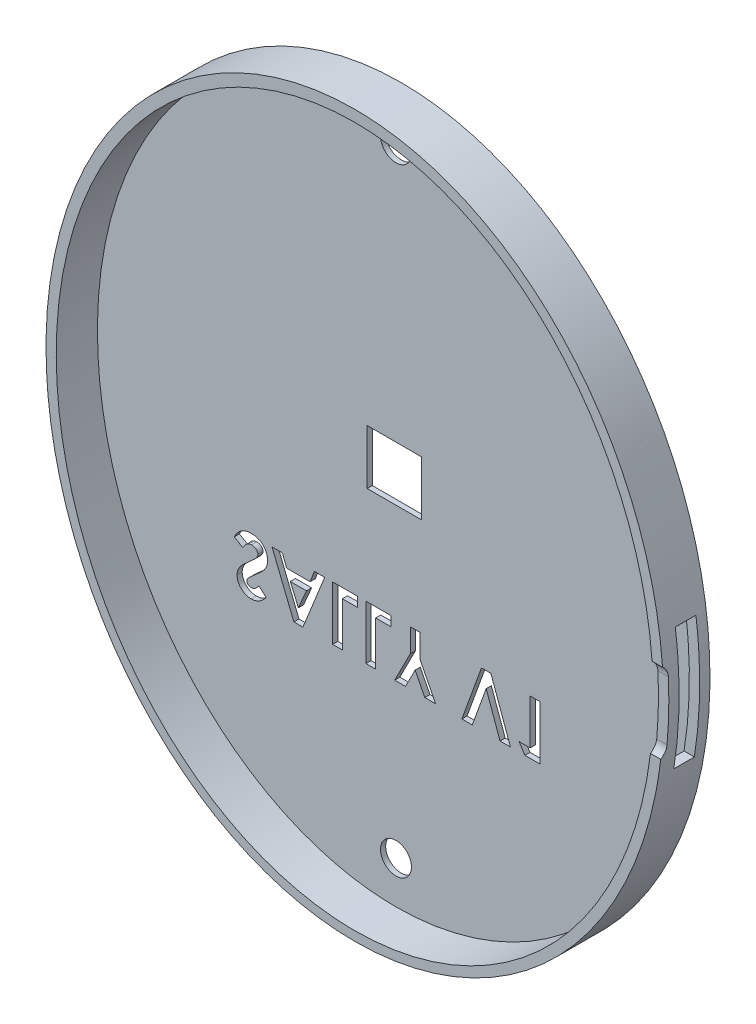
from build123d import *

# Parameters (mm, degrees)
SKETCH3_RX                     = 35
SKETCH3_RY                     = 30
BOSS_EXTRUDE2_DEPTH            = 4.5
SKETCH4_RX                     = 34
SKETCH4_RY                     = 29
CUT_EXTRUDE1_DEPTH             = 4
SCREWCUT_REACH                 = 48.274
SKETCH5_R                      = 1.5
SCREWCUT_DIRECTION_2_DEPTH     = 47.273686
LPATTERN1_COUNT                = 2
LPATTERN1_PITCH                = 60
SKETCH7_W                      = 5.3
SKETCH7_H                      = 5.3
CUT_EXTRUDE5_DEPTH             = 0.5
SALLYTV_START                  = -0.5
SALLYTV_DEPTH                  = 0.5
CUT_EXTRUDE6_REACH             = 71.604
SKETCH9_W                      = 2
SKETCH9_H                      = 12
CUT_EXTRUDE6_DIRECTION_2_DEPTH = 70.604181201


# Read off the part's stored shape, not the designer's step: SallyTV
with BuildPart() as part:
    # Sketch3 → Boss-Extrude2 (new body)
    with BuildSketch(Plane.XY):
        with Locations(Location((0.004233302, 0), (0, 0, 90))):
            Ellipse(SKETCH3_RX, SKETCH3_RY)
    extrude(amount=BOSS_EXTRUDE2_DEPTH)

    # Sketch4 → Cut-Extrude1 (cut)
    with BuildSketch(Plane.XY.offset(4.5)):
        with Locations(Location((0, -0.09801596), (0, 0, -90))):
            Ellipse(SKETCH4_RX, SKETCH4_RY)
    extrude(amount=-CUT_EXTRUDE1_DEPTH, mode=Mode.SUBTRACT)

    # Sketch5 → ScrewCut (cut, up to next)
    with BuildSketch(Plane.XY.offset(0.5), mode=Mode.PRIVATE) as screwcut_sk1:
        with Locations((0, -30)):
            Circle(SKETCH5_R)
    screwcut_tool1 = extrude(screwcut_sk1.sketch, amount=-SCREWCUT_REACH, mode=Mode.PRIVATE) & part.part
    screwcut = screwcut_tool1.solids().sort_by_distance((0, -30, 0.5))[0]
    add(screwcut, mode=Mode.SUBTRACT)

    # Sketch5 → ScrewCut direction 2 (cut)
    with BuildSketch(Plane.XY.offset(0.5)):
        with Locations((0, -30)):
            Circle(SKETCH5_R)
    screwcut_direction_2 = extrude(amount=SCREWCUT_DIRECTION_2_DEPTH, mode=Mode.SUBTRACT)

    # LPattern1: ScrewCut, ScrewCut direction 2 ×2
    with Locations(*[(0, i * LPATTERN1_PITCH, 0) for i in range(1, LPATTERN1_COUNT)]):
        add(screwcut, mode=Mode.SUBTRACT)
        add(screwcut_direction_2, mode=Mode.SUBTRACT)

    # Sketch7 → Cut-Extrude5 (cut)
    with BuildSketch(Plane(origin=(0, 0, 0), x_dir=(-1, 0, 0), z_dir=(0, 0, -1))):
        with Locations((0.15, 2.35)):
            Rectangle(SKETCH7_W, SKETCH7_H)
    extrude(amount=-CUT_EXTRUDE5_DEPTH, mode=Mode.SUBTRACT)

    # SallyTV outline → SallyTV (cut)
    # profile 1 of 7: a face of its own
    with BuildSketch(Plane(origin=(0, 0, 0), x_dir=(-1, 0, 0), z_dir=(0, 0, -1)).offset(SALLYTV_START)):
        with BuildLine():
            add(Edge.make_bspline(
                [(14.05841167, -15.219426964), (13.996554846, -15.217164109), (13.873329474, -15.212656263), (13.691137208, -15.177406375), (13.51317942, -15.121972214), (13.369777699, -15.055096997), (13.255675626, -14.990314942), (13.168227046, -14.930671787), (13.079243409, -14.862347348), (12.988007117, -14.785126315), (12.896213481, -14.697553743), (12.80125237, -14.601714367), (12.704417745, -14.49677991), (12.641490591, -14.42181522), (12.60919292, -14.383339223)],
                knots=[0, 0, 0, 0, 0.10691022, 0.212976528, 0.319776676, 0.428556273, 0.485856803, 0.546558687, 0.611431498, 0.67982091, 0.753158505, 0.830752869, 0.913133075, 1, 1, 1, 1], degree=3))
            add(Edge.make_bspline(
                [(15.436115996, -13.887996675), (15.434977205, -13.932944359), (15.432733663, -14.021496124), (15.412720922, -14.151698591), (15.382811118, -14.277333033), (15.339373496, -14.397941076), (15.282996707, -14.513371655), (15.214529287, -14.624189851), (15.132908067, -14.729375717), (15.040926462, -14.828859524), (14.939586283, -14.919776402), (14.831291423, -15.000019657), (14.716654841, -15.067794277), (14.596377826, -15.124018246), (14.46971507, -15.167054122), (14.337599692, -15.197560096), (14.199842197, -15.215704077), (14.106142523, -15.218170541), (14.05841167, -15.219426964)],
                knots=[0, 0, 0, 0, 0.06317288, 0.12445736, 0.184840915, 0.244566821, 0.304319173, 0.365199786, 0.427420983, 0.491261689, 0.555499002, 0.618604518, 0.680494764, 0.742473305, 0.804990665, 0.868251971, 0.932887217, 1, 1, 1, 1], degree=3))
            add(Edge.make_bspline(
                [(14.11309917, -12.045448598), (14.179922799, -12.101987797), (14.30817757, -12.210503632), (14.489417834, -12.370778104), (14.65273154, -12.520569284), (14.796708135, -12.661728919), (14.923182103, -12.791650116), (15.03129691, -12.911388146), (15.119864863, -13.021866624), (15.213063536, -13.152720988), (15.301620909, -13.312176022), (15.37815961, -13.504018913), (15.427814688, -13.695837461), (15.433377849, -13.82461387), (15.436115996, -13.887996675)],
                knots=[0, 0, 0, 0, 0.112124581, 0.215201009, 0.309902452, 0.395959096, 0.473447494, 0.542140328, 0.602523333, 0.654726333, 0.747804055, 0.835278417, 0.918925243, 1, 1, 1, 1], degree=3))
            add(Edge.make_bspline(
                [(13.416885227, -11.1399498), (13.418613888, -11.169907445), (13.422125496, -11.230763533), (13.44799092, -11.32124675), (13.488426466, -11.411688816), (13.536264569, -11.485871846), (13.584945829, -11.547983287), (13.631496094, -11.60180004), (13.688182002, -11.661258131), (13.754859824, -11.726432353), (13.830648571, -11.797896451), (13.915612085, -11.875643428), (14.010723289, -11.958988426), (14.077948075, -12.015762214), (14.11309917, -12.045448598)],
                knots=[0, 0, 0, 0, 0.076346606, 0.155090822, 0.238351561, 0.32840414, 0.37938386, 0.439617644, 0.509831416, 0.588874645, 0.677436354, 0.77554672, 0.882635872, 1, 1, 1, 1], degree=3))
            add(Edge.make_bspline(
                [(14.016344362, -10.642503887), (13.975485845, -10.64415631), (13.896214373, -10.647362252), (13.78306449, -10.676974573), (13.679324393, -10.723468089), (13.589652219, -10.789807925), (13.513723476, -10.866374178), (13.457683705, -10.951557636), (13.422479144, -11.043724081), (13.418757168, -11.107748957), (13.416885227, -11.1399498)],
                knots=[0, 0, 0, 0, 0.141985893, 0.275473311, 0.404345843, 0.535429711, 0.661427401, 0.77786684, 0.888279749, 1, 1, 1, 1], degree=3))
            add(Edge.make_bspline(
                [(14.876620804, -11.31558081), (14.846022588, -11.262393789), (14.787363193, -11.160429725), (14.687959364, -11.023428081), (14.586125216, -10.906108851), (14.479506435, -10.81054566), (14.369399465, -10.735460705), (14.255272464, -10.681799787), (14.137045248, -10.64858374), (14.056514239, -10.644527293), (14.016344362, -10.642503887)],
                knots=[0, 0, 0, 0, 0.160457921, 0.307611547, 0.442138888, 0.566229194, 0.681222208, 0.789558005, 0.895028892, 1, 1, 1, 1], degree=3))
            Line((14.876620804, -11.31558081), (15.705346766, -10.818134896))
            add(Edge.make_bspline(
                [(14.051049891, -9.700196194), (14.095951277, -9.700992775), (14.184881774, -9.702570461), (14.315951881, -9.715450956), (14.442514886, -9.736238705), (14.564428227, -9.766033758), (14.682241146, -9.803788132), (14.79595848, -9.849903654), (14.904795201, -9.905095096), (15.009574819, -9.968227504), (15.109787977, -10.041532545), (15.206701829, -10.123511522), (15.299353736, -10.215425309), (15.388188686, -10.317056533), (15.472638288, -10.428692989), (15.555466881, -10.548779932), (15.632993312, -10.679546015), (15.680884838, -10.771279479), (15.705346766, -10.818134896)],
                knots=[0, 0, 0, 0, 0.063551482, 0.125868382, 0.18624025, 0.244976651, 0.303357688, 0.361230317, 0.418489049, 0.475936712, 0.534203744, 0.594059429, 0.655468694, 0.718771685, 0.784974607, 0.853522316, 0.925182451, 1, 1, 1, 1], degree=3))
            add(Edge.make_bspline(
                [(12.474577535, -11.1946373), (12.475517293, -11.141614668), (12.477361133, -11.03758229), (12.499944634, -10.885346402), (12.532147382, -10.739650049), (12.581938479, -10.602078615), (12.642623573, -10.470373906), (12.718701104, -10.346587463), (12.808043731, -10.229466517), (12.910444101, -10.121104747), (13.023711068, -10.022773951), (13.145200656, -9.935237554), (13.27610085, -9.862965109), (13.41529326, -9.803453905), (13.562703378, -9.75761758), (13.718155596, -9.723740264), (13.881887688, -9.703407633), (13.993850052, -9.701282097), (14.051049891, -9.700196194)],
                knots=[0, 0, 0, 0, 0.065200875, 0.127926544, 0.18904691, 0.248543693, 0.307607127, 0.36724766, 0.426963056, 0.488617128, 0.550391855, 0.611330734, 0.672556085, 0.734024191, 0.797340621, 0.862249627, 0.929625466, 1, 1, 1, 1], degree=3))
            add(Edge.make_bspline(
                [(13.017245804, -12.398813983), (12.970896427, -12.348654031), (12.881796648, -12.252228987), (12.765998345, -12.102800495), (12.670692596, -11.956927817), (12.596962261, -11.811866123), (12.541278146, -11.665522461), (12.502020108, -11.514307761), (12.478508208, -11.356641924), (12.475897838, -11.249054238), (12.474577535, -11.1946373)],
                knots=[0, 0, 0, 0, 0.150833097, 0.289954183, 0.417138648, 0.535255184, 0.648751095, 0.762405462, 0.879826701, 1, 1, 1, 1], degree=3))
            add(Edge.make_bspline(
                [(13.693477775, -13.004583214), (13.6493153, -12.966362818), (13.565504096, -12.893828449), (13.446257396, -12.790877558), (13.341459408, -12.698255151), (13.249583462, -12.617351293), (13.17202231, -12.547317118), (13.108449884, -12.487817861), (13.058089754, -12.440011866), (13.029462969, -12.411137016), (13.017245804, -12.398813983)],
                knots=[0, 0, 0, 0, 0.192952702, 0.366184141, 0.520457298, 0.655012135, 0.770624226, 0.865677185, 0.942674527, 1, 1, 1, 1], degree=3))
            add(Edge.make_bspline(
                [(14.406518641, -13.681866867), (14.394444822, -13.66662424), (14.366652485, -13.631537724), (14.313658192, -13.575966153), (14.247108488, -13.507886114), (14.164442403, -13.42963868), (14.069091632, -13.338409768), (13.956636544, -13.237785621), (13.830314087, -13.124650025), (13.740527011, -13.045866493), (13.693477775, -13.004583214)],
                knots=[0, 0, 0, 0, 0.059234189, 0.136349281, 0.233805212, 0.349411224, 0.48317915, 0.635966856, 0.809243356, 1, 1, 1, 1], degree=3))
            add(Edge.make_bspline(
                [(14.493808304, -13.933219031), (14.492880859, -13.91136705), (14.491013112, -13.867360196), (14.472973221, -13.802862671), (14.445781955, -13.739841082), (14.419799589, -13.701476841), (14.406518641, -13.681866867)],
                knots=[0, 0, 0, 0, 0.241881375, 0.487115475, 0.73783784, 1, 1, 1, 1], degree=3))
            add(Edge.make_bspline(
                [(14.068928496, -14.277119271), (14.09883685, -14.276070387), (14.156582024, -14.274045268), (14.238902053, -14.253915735), (14.311986947, -14.219175116), (14.375765378, -14.173748835), (14.426287305, -14.119020698), (14.466625147, -14.061624953), (14.489338741, -13.998273032), (14.492328297, -13.954760376), (14.493808304, -13.933219031)],
                knots=[0, 0, 0, 0, 0.148126258, 0.285992887, 0.416634394, 0.547379946, 0.671582838, 0.784400739, 0.893265576, 1, 1, 1, 1], degree=3))
            add(Edge.make_bspline(
                [(13.313820323, -13.738657733), (13.34400354, -13.781234298), (13.401951107, -13.862975365), (13.495878068, -13.97242858), (13.589380901, -14.065800319), (13.683325853, -14.142700515), (13.778545615, -14.202661945), (13.874874901, -14.2451153), (13.971767592, -14.2721033), (14.036864524, -14.275463956), (14.068928496, -14.277119271)],
                knots=[0, 0, 0, 0, 0.162420307, 0.31182434, 0.448432767, 0.573381197, 0.689077147, 0.797572901, 0.900293043, 1, 1, 1, 1], degree=3))
            Line((13.313820323, -13.738657733), (12.60919292, -14.383339223))
        make_face()
    # profile 2 of 7: a face of its own
    with BuildSketch(Plane(origin=(0, 0, 0), x_dir=(-1, 0, 0), z_dir=(0, 0, -1)).offset(SALLYTV_START)):
        Polygon((-12.520765013, -15.084811579), (-11.958114773, -14.209811579), (-13.03503785, -14.209811579), (-13.03503785, -9.834811579), (-13.977345542, -9.834811579), (-13.977345542, -15.084811579), align=None)
    # profile 3 of 7: a face of its own
    with BuildSketch(Plane(origin=(0, 0, 0), x_dir=(-1, 0, 0), z_dir=(0, 0, -1)).offset(SALLYTV_START)):
        Polygon((-7.411690494, -15.084811579), (-6.405230157, -15.084811579), (-8.305620782, -9.834811579), (-9.214274629, -9.834811579), (-11.116768619, -15.084811579), (-10.111359965, -15.084811579), (-8.760999388, -11.355544752), align=None)
    # profile 4 of 7: a face of its own
    with BuildSketch(Plane(origin=(0, 0, 0), x_dir=(-1, 0, 0), z_dir=(0, 0, -1)).offset(SALLYTV_START)):
        Polygon((-0.924911648, -15.084811579), (0.123615996, -15.084811579), (-1.39080708, -12.10854956), (-1.39080708, -9.834811579), (-2.333114773, -9.834811579), (-2.333114773, -12.10854956), (-3.84753785, -15.084811579), (-2.801113571, -15.084811579), (-1.861960927, -13.242263502), align=None)
    # profile 5 of 7: a face of its own
    with BuildSketch(Plane(origin=(0, 0, 0), x_dir=(-1, 0, 0), z_dir=(0, 0, -1)).offset(SALLYTV_START)):
        Polygon((1.974577535, -15.084811579), (2.916885227, -15.084811579), (2.916885227, -9.834811579), (0.493808304, -9.834811579), (0.493808304, -10.777119271), (1.974577535, -10.777119271), align=None)
    # profile 6 of 7: a face of its own
    with BuildSketch(Plane(origin=(0, 0, 0), x_dir=(-1, 0, 0), z_dir=(0, 0, -1)).offset(SALLYTV_START)):
        Polygon((5.205346766, -15.084811579), (6.147654458, -15.084811579), (6.147654458, -9.834811579), (3.724577535, -9.834811579), (3.724577535, -10.777119271), (5.205346766, -10.777119271), align=None)
    # profile 7 of 7: a face of its own
    with BuildSketch(Plane(origin=(0, 0, 0), x_dir=(-1, 0, 0), z_dir=(0, 0, -1)).offset(SALLYTV_START)):
        Polygon((9.041885227, -15.084811579), (9.91793691, -15.084811579), (12.037077535, -9.834811579), (11.030617198, -9.834811579), (10.621512631, -10.911734656), (8.336206141, -10.911734656), (7.928153256, -9.834811579), (6.92169292, -9.834811579), align=None)
        Polygon((10.263940516, -11.854042348), (9.479385227, -13.676608454), (8.693778256, -11.854042348), align=None, mode=Mode.SUBTRACT)
    extrude(amount=SALLYTV_DEPTH, mode=Mode.SUBTRACT)

    # Sketch9 → Cut-Extrude6 (cut, up to next)
    with BuildSketch(Plane(origin=(30, 0, 0), x_dir=(0, 0, -1), z_dir=(1, 0, 0)), mode=Mode.PRIVATE) as cut_extrude6_sk1:
        with Locations((-2, -0.492037455)):
            Rectangle(SKETCH9_W, SKETCH9_H)
    cut_extrude6_tool1 = extrude(cut_extrude6_sk1.sketch, amount=-CUT_EXTRUDE6_REACH, mode=Mode.PRIVATE) & part.part
    # Sketch9 → Cut-Extrude6 (cut, up to next)
    with BuildSketch(Plane(origin=(30, 0, 0), x_dir=(0, 0, -1), z_dir=(1, 0, 0)), mode=Mode.PRIVATE) as cut_extrude6_sk2:
        with BuildLine():
            Line((-4, 1.99336728), (-4, -3.80663272))
            ThreePointArc((-4, -3.80663272), (-5.284400565, -5.091033286), (-6.56880113, -3.80663272))
            Line((-6.56880113, -3.80663272), (-6.56880113, 1.99336728))
            ThreePointArc((-6.56880113, 1.99336728), (-5.284400565, 3.277767845), (-4, 1.99336728))
        make_face()
    cut_extrude6_tool2 = extrude(cut_extrude6_sk2.sketch, amount=-CUT_EXTRUDE6_REACH, mode=Mode.PRIVATE) & part.part
    add(cut_extrude6_tool1.solids().sort_by_distance((30, -0.492037, 2))[0], mode=Mode.SUBTRACT)
    add(cut_extrude6_tool2.solids().sort_by_distance((30, -0.906633, 5.284401))[0], mode=Mode.SUBTRACT)

    # Sketch9 → Cut-Extrude6 direction 2 (cut)
    with BuildSketch(Plane(origin=(30, 0, 0), x_dir=(0, 0, -1), z_dir=(1, 0, 0))):
        with Locations((-2, -0.492037455)):
            Rectangle(SKETCH9_W, SKETCH9_H)
        with BuildLine():
            Line((-4, 1.99336728), (-4, -3.80663272))
            ThreePointArc((-4, -3.80663272), (-5.284400565, -5.091033286), (-6.56880113, -3.80663272))
            Line((-6.56880113, -3.80663272), (-6.56880113, 1.99336728))
            ThreePointArc((-6.56880113, 1.99336728), (-5.284400565, 3.277767845), (-4, 1.99336728))
        make_face()
    extrude(amount=CUT_EXTRUDE6_DIRECTION_2_DEPTH, mode=Mode.SUBTRACT)


solid = part.part
